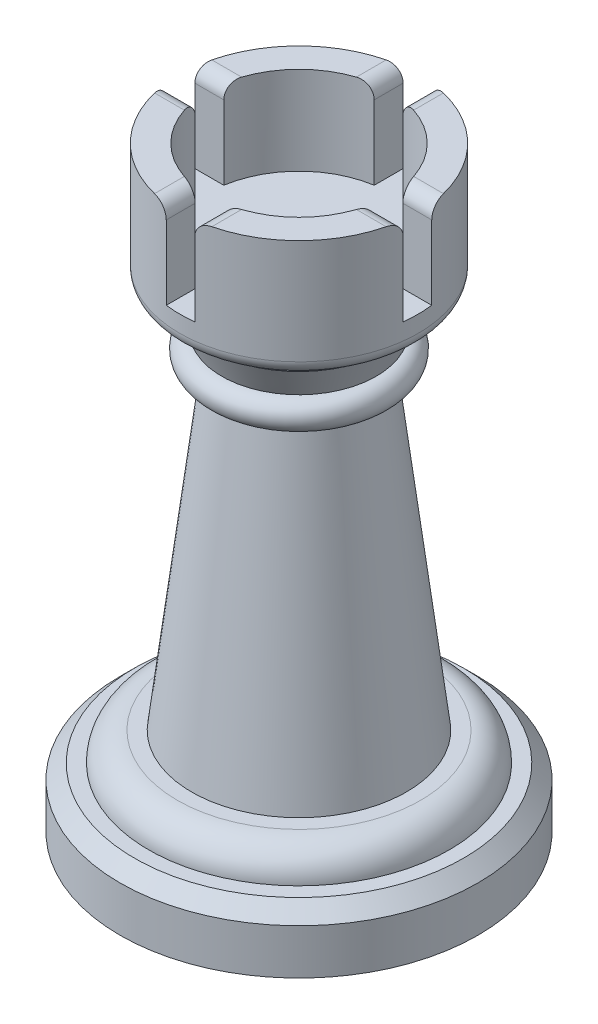
from build123d import *

# Parameters (mm, degrees)
CHAMFER1_SIZE      = 0.762
FILLET1_R          = 0.762
CUT_EXTRUDE4_START = -4.699
SKETCH2_W          = 1.524
SKETCH2_H          = 1.524
CUT_EXTRUDE4_DEPTH = 4.699
FILLET2_R          = 0.762
FILLET3_R          = 1.524


with BuildPart() as part:
    # Sketch1 → Revolve1 (revolve)
    with BuildSketch(Plane.XY, mode=Mode.PRIVATE) as revolve1_sk:
        with BuildLine():
            Line((0, 0), (0, 31.75))
            Line((0, 31.75), (-6.35, 31.75))
            Line((-6.35, 31.75), (-6.35, 25.4))
            Line((-6.35, 25.4), (-4.826, 25.4))
            Line((-4.826, 25.4), (-4.826, 24.638))
            Line((-4.826, 24.638), (-4.112783335, 23.0632))
            ThreePointArc((-4.112783335, 23.0632), (-4.874783335, 22.3012), (-4.112783335, 21.5392))
            Line((-4.112783335, 21.5392), (-3.683, 21.5392))
            Line((-3.683, 21.5392), (-5.715, 4.699))
            Line((-5.715, 4.699), (-8.001, 4.699))
            Line((-8.001, 4.699), (-8.001, 3.175))
            Line((-8.001, 3.175), (-9.525, 3.175))
            Line((-9.525, 3.175), (-9.525, 0))
            Line((-9.525, 0), (0, 0))
        make_face()
    revolve(revolve1_sk.sketch.rotate(Axis((0, 0, 0), (0, 1, 0)), 270), axis=Axis((0, 0, 0), (0, 1, 0)))

    # Chamfer1
    chamfer1_edges = [part.edges().sort_by_distance(p)[0] for p in [
        (0, 3.175, 9.525),
    ]]
    chamfer(chamfer1_edges, length=CHAMFER1_SIZE)

    # Fillet1
    fillet1_edges = [part.edges().sort_by_distance(p)[0] for p in [
        (0, 25.4, 4.826),
        (0, 25.4, 6.35),
    ]]
    fillet(fillet1_edges, radius=FILLET1_R - 0.0001)  # a hair under: the kernel refuses the full size

    # Sketch2 → Cut-Extrude4 (cut)
    with BuildSketch(Plane(origin=(0, 31.75, 0), x_dir=(1, 0, 0), z_dir=(0, 1, 0)).offset(CUT_EXTRUDE4_START)):
        with BuildLine():
            Line((0.762, 4.765462412), (0.762, 0.762))
            Line((0.762, 0.762), (4.765462412, 0.762))
            ThreePointArc((4.765462412, 0.762), (3.412497326, 3.412497326), (0.762, 4.765462412))
        make_face()
        with BuildLine():
            ThreePointArc((-0.762, 4.765462412), (-3.412497326, 3.412497326), (-4.765462412, 0.762))
            Line((-4.765462412, 0.762), (-0.762, 0.762))
            Line((-0.762, 0.762), (-0.762, 4.765462412))
        make_face()
        with BuildLine():
            Line((-0.762, -0.762), (-4.765462412, -0.762))
            ThreePointArc((-4.765462412, -0.762), (-3.412497326, -3.412497326), (-0.762, -4.765462412))
            Line((-0.762, -4.765462412), (-0.762, -0.762))
        make_face()
        with BuildLine():
            Line((4.765462412, -0.762), (0.762, -0.762))
            Line((0.762, -0.762), (0.762, -4.765462412))
            ThreePointArc((0.762, -4.765462412), (3.412497326, -3.412497326), (4.765462412, -0.762))
        make_face()
        with BuildLine():
            Line((-4.765462412, 0.762), (-6.304114212, 0.762))
            ThreePointArc((-6.304114212, 0.762), (-6.35, 0), (-6.304114212, -0.762))
            Line((-6.304114212, -0.762), (-4.765462412, -0.762))
            ThreePointArc((-4.765462412, -0.762), (-4.826, 0), (-4.765462412, 0.762))
        make_face()
        with BuildLine():
            ThreePointArc((6.35, 0), (6.338518173, 0.381690158), (6.304114212, 0.762))
            Line((6.304114212, 0.762), (4.765462412, 0.762))
            ThreePointArc((4.765462412, 0.762), (4.810841797, 0.382200471), (4.826, 0))
            ThreePointArc((4.826, 0), (4.810841797, -0.382200471), (4.765462412, -0.762))
            Line((4.765462412, -0.762), (6.304114212, -0.762))
            ThreePointArc((6.304114212, -0.762), (6.338518173, -0.381690158), (6.35, 0))
        make_face()
        with BuildLine():
            ThreePointArc((0.762, 6.304114212), (0, 6.35), (-0.762, 6.304114212))
            Line((-0.762, 6.304114212), (-0.762, 4.765462412))
            ThreePointArc((-0.762, 4.765462412), (0, 4.826), (0.762, 4.765462412))
            Line((0.762, 4.765462412), (0.762, 6.304114212))
        make_face()
        with BuildLine():
            Line((-0.762, -4.765462412), (-0.762, -6.304114212))
            ThreePointArc((-0.762, -6.304114212), (0, -6.35), (0.762, -6.304114212))
            Line((0.762, -6.304114212), (0.762, -4.765462412))
            ThreePointArc((0.762, -4.765462412), (0, -4.826), (-0.762, -4.765462412))
        make_face()
        with BuildLine():
            Line((0.762, -0.762), (-0.762, -0.762))
            Line((-0.762, -0.762), (-0.762, -4.765462412))
            ThreePointArc((-0.762, -4.765462412), (0, -4.826), (0.762, -4.765462412))
            Line((0.762, -4.765462412), (0.762, -0.762))
        make_face()
        Rectangle(SKETCH2_W, SKETCH2_H)
        with BuildLine():
            Line((-0.762, 0.762), (-4.765462412, 0.762))
            ThreePointArc((-4.765462412, 0.762), (-4.826, 0), (-4.765462412, -0.762))
            Line((-4.765462412, -0.762), (-0.762, -0.762))
            Line((-0.762, -0.762), (-0.762, 0.762))
        make_face()
        with BuildLine():
            Line((-0.762, 4.765462412), (-0.762, 0.762))
            Line((-0.762, 0.762), (0.762, 0.762))
            Line((0.762, 0.762), (0.762, 4.765462412))
            ThreePointArc((0.762, 4.765462412), (0, 4.826), (-0.762, 4.765462412))
        make_face()
        with BuildLine():
            Line((4.765462412, 0.762), (0.762, 0.762))
            Line((0.762, 0.762), (0.762, -0.762))
            Line((0.762, -0.762), (4.765462412, -0.762))
            ThreePointArc((4.765462412, -0.762), (4.810841797, -0.382200471), (4.826, 0))
            ThreePointArc((4.826, 0), (4.810841797, 0.382200471), (4.765462412, 0.762))
        make_face()
    extrude(amount=CUT_EXTRUDE4_DEPTH, mode=Mode.SUBTRACT)

    # Fillet2
    fillet2_edges = [part.edges().sort_by_distance(p)[0] for p in [
        (5.534788312, 31.75, -0.762),
        (0.762, 31.75, 5.534788312),
        (-5.534788312, 31.75, -0.762),
        (0.762, 31.75, -5.534788312),
        (-0.762, 31.75, -5.534788312),
        (-5.534788312, 31.75, 0.762),
        (-0.762, 31.75, 5.534788312),
        (5.534788312, 31.75, 0.762),
    ]]
    fillet(fillet2_edges, radius=FILLET2_R)

    # Fillet3
    fillet3_edges = [part.edges().sort_by_distance(p)[0] for p in [
        (0, 4.699, 8.001),
    ]]
    fillet(fillet3_edges, radius=FILLET3_R - 0.0001)  # a hair under: the kernel refuses the full size


solid = part.part
